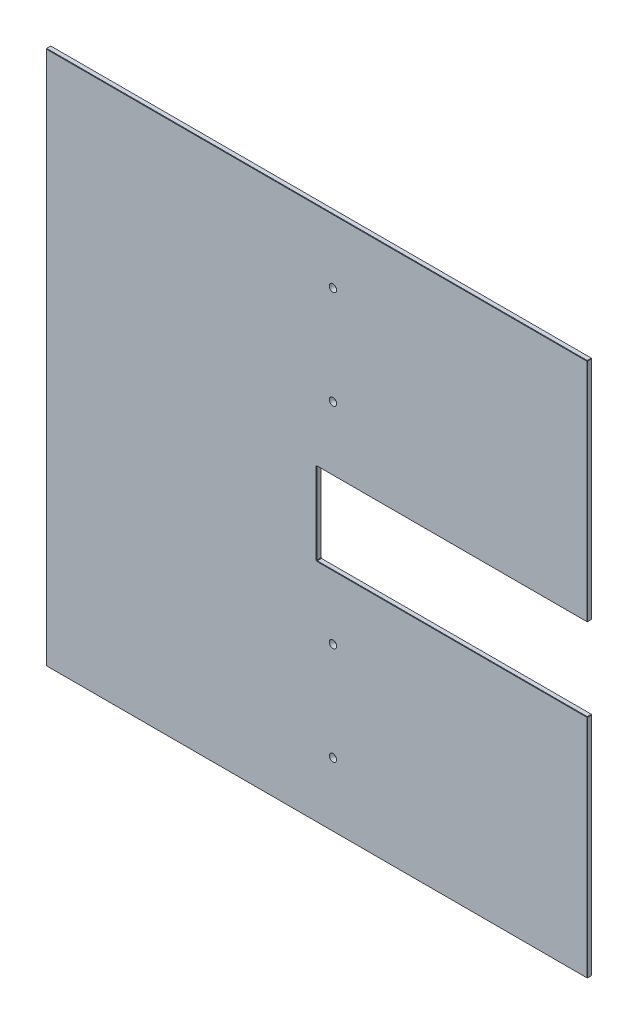
from build123d import *

# Parameters (mm, degrees)
SKIZZE1_W                       = 330
SKIZZE1_H                       = 326
AUFSATZ_LINEAR_AUSTRAGEN1_DEPTH = 3
SKIZZE2_W                       = 165
SKIZZE2_H                       = 50
SCHNITT_LINEAR_AUSTRAGEN1_DEPTH = 3
DURCHGANGSLOCH_F_R_M41_D        = 4.5
FASE1_SIZE                      = 0.25


with BuildPart() as part:
    # Skizze1 → Aufsatz-Linear austragen1 (new body)
    with BuildSketch(Plane.XY):
        Rectangle(SKIZZE1_W, SKIZZE1_H)
    extrude(amount=AUFSATZ_LINEAR_AUSTRAGEN1_DEPTH)

    # Skizze2 → Schnitt-Linear austragen1 (cut)
    with BuildSketch(Plane.XY.offset(3)):
        with Locations((82.5, 0)):
            Rectangle(SKIZZE2_W, SKIZZE2_H)
    extrude(amount=-SCHNITT_LINEAR_AUSTRAGEN1_DEPTH, mode=Mode.SUBTRACT)

    # Durchgangsloch für M41 (through all)
    with Locations(Plane.XY.offset(3)):
        with Locations((10, -64), (10, -124), (10, 64), (10, 124)):
            Hole(DURCHGANGSLOCH_F_R_M41_D / 2)

    # Fase1
    fase1_edges = [part.edges().sort_by_distance(p)[0] for p in [
        (82.5, 25, 0),
        (0, 25, 1.5),
        (0, 0, 0),
        (165, 94, 0),
        (82.5, 25, 3),
        (165, 25, 1.5),
        (0, 0, 3),
        (0, -25, 1.5),
        (82.5, -25, 0),
        (0, 163, 0),
        (165, 163, 1.5),
        (165, 94, 3),
        (165, -25, 1.5),
        (82.5, -25, 3),
        (165, -94, 0),
        (0, -163, 0),
        (-165, 0, 0),
        (-165, 163, 1.5),
        (0, 163, 3),
        (165, -94, 3),
        (165, -163, 1.5),
        (-165, -163, 1.5),
        (-165, 0, 3),
        (0, -163, 3),
    ]]
    chamfer(fase1_edges, length=FASE1_SIZE)


solid = part.part
